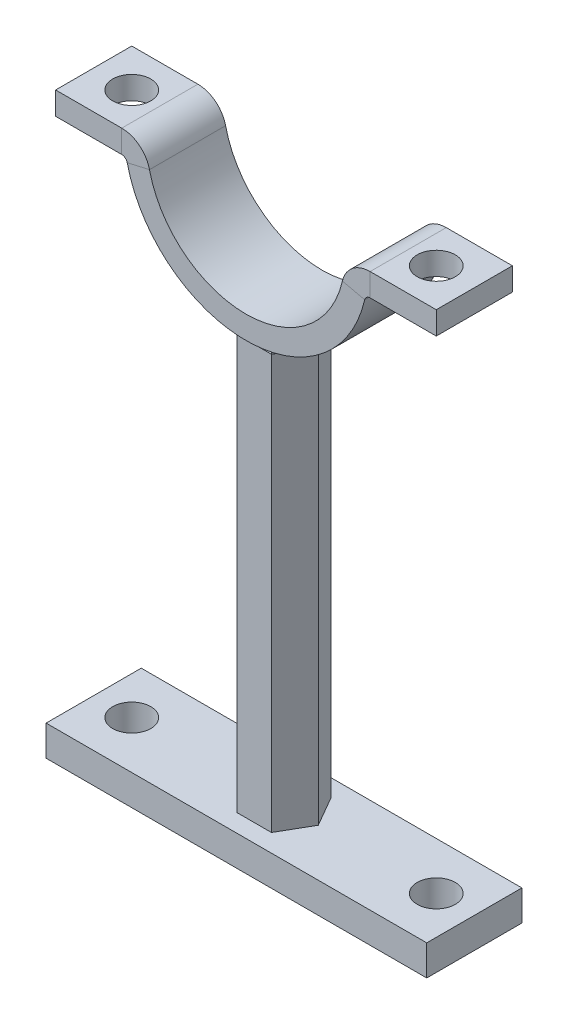
from build123d import *

# Parameters (mm, degrees)
BASE_FLANGE1_START  = -5
BASE_FLANGE1_DEPTH  = 10
SKETCH7_R           = 2.5
CUT_EXTRUDE2_DEPTH  = 10
BOSS_EXTRUDE1_START = 1
BOSS_EXTRUDE1_DEPTH = 2
BOSS_EXTRUDE1_DRAFT = -15
BOSS_EXTRUDE2_DEPTH = 54.4
BOSS_EXTRUDE3_START = 4
SKETCH10_W          = 50
SKETCH10_H          = 12.5
SKETCH10_R          = 2.5
BOSS_EXTRUDE3_DEPTH = 4


# Read off the part's stored shape, not the designer's step: Base-Flange1
with BuildPart() as part:
    # Base-Flange1 outline → Base-Flange1 (new body)
    with BuildSketch(Plane.XY.offset(BASE_FLANGE1_START)):
        with BuildLine():
            Line((-16.314153364, 0), (-25, 0))
            Line((-25, 0), (-25, -3))
            Line((-25, -3), (-16.314153364, -3))
            ThreePointArc((-16.314153364, -3), (-15.855108879, -3.160529066), (-15.596145802, -3.57214727))
            ThreePointArc((-15.596145802, -3.57214727), (0, -16), (15.596145802, -3.57214727))
            ThreePointArc((15.596145802, -3.57214727), (15.855108879, -3.160529066), (16.314153364, -3))
            Line((16.314153364, -3), (25, -3))
            Line((25, -3), (25, 0))
            Line((25, 0), (16.314153364, 0))
            ThreePointArc((16.314153364, 0), (13.985527754, -0.814326513), (12.671868464, -2.902369657))
            ThreePointArc((12.671868464, -2.902369657), (0, -13), (-12.671868464, -2.902369657))
            ThreePointArc((-12.671868464, -2.902369657), (-13.985527754, -0.814326513), (-16.314153364, 0))
        make_face()
    extrude(amount=BASE_FLANGE1_DEPTH)

    # Sketch7 → Cut-Extrude2 (cut)
    with BuildSketch(Plane.XZ.offset(3)):
        with Locations(Location((-20, 0, 0), (0, 0, 270))):
            Circle(SKETCH7_R)
    cut_extrude2 = extrude(amount=-CUT_EXTRUDE2_DEPTH, mode=Mode.SUBTRACT)

    # Mirror1: Cut-Extrude2 across plane
    add(cut_extrude2.mirror(Plane(origin=(0, 0, 0), x_dir=(0, 0, 1), z_dir=(1, 0, 0))), mode=Mode.SUBTRACT)


with BuildPart() as boss_extrude1_tool:
    # Sketch8 → Boss-Extrude1 (with draft: the straight prism first)
    with BuildSketch(Plane(origin=(0, -16, 0), x_dir=(-1, 0, 0), z_dir=(0, -1, 0)).offset(BOSS_EXTRUDE1_START)):
        Polygon((-2.25, -3.897114317), (2.25, -3.897114317), (4.5, 0), (2.25, 3.897114317), (-2.25, 3.897114317), (-4.5, 0), align=None)
    extrude(amount=-BOSS_EXTRUDE1_DEPTH)
    # Boss-Extrude1: the draft: its side faces are tilted about the plane it starts from
    boss_extrude1_sides = [boss_extrude1_tool.faces().sort_by_distance(p)[0] for p in [
        (0, -16, 3.897114317),
        (-3.375, -16, 1.948557159),
        (-3.375, -16, -1.948557159),
        (0, -16, -3.897114317),
        (3.375, -16, -1.948557159),
        (3.375, -16, 1.948557159),
    ]]
    draft(boss_extrude1_sides, Plane(origin=(0, -16, 0), x_dir=(-1, 0, 0), z_dir=(0, -1, 0)).offset(BOSS_EXTRUDE1_START), BOSS_EXTRUDE1_DRAFT)


with BuildPart() as part_1:
    add(part.part)

    # Boss-Extrude1: add boss_extrude1_tool
    add(boss_extrude1_tool.part)

    # Sketch9 → Boss-Extrude2 (add)
    with BuildSketch(Plane.XZ.offset(17)):
        Polygon((4.5, 0), (2.25, 3.897114317), (-2.25, 3.897114317), (-4.5, 0), (-2.25, -3.897114317), (2.25, -3.897114317), align=None)
    extrude(amount=BOSS_EXTRUDE2_DEPTH)

    # Sketch10 → Boss-Extrude3 (add)
    with BuildSketch(Plane.XZ.offset(71.4).offset(BOSS_EXTRUDE3_START)):
        Rectangle(SKETCH10_W, SKETCH10_H)
        with Locations(Location((-20, 0, 0), (0, 0, 270))):
            Circle(SKETCH10_R, mode=Mode.SUBTRACT)
        with Locations(Location((20, 0, 0), (0, 0, 270))):
            Circle(SKETCH10_R, mode=Mode.SUBTRACT)
    extrude(amount=-BOSS_EXTRUDE3_DEPTH)


solid = part_1.part
